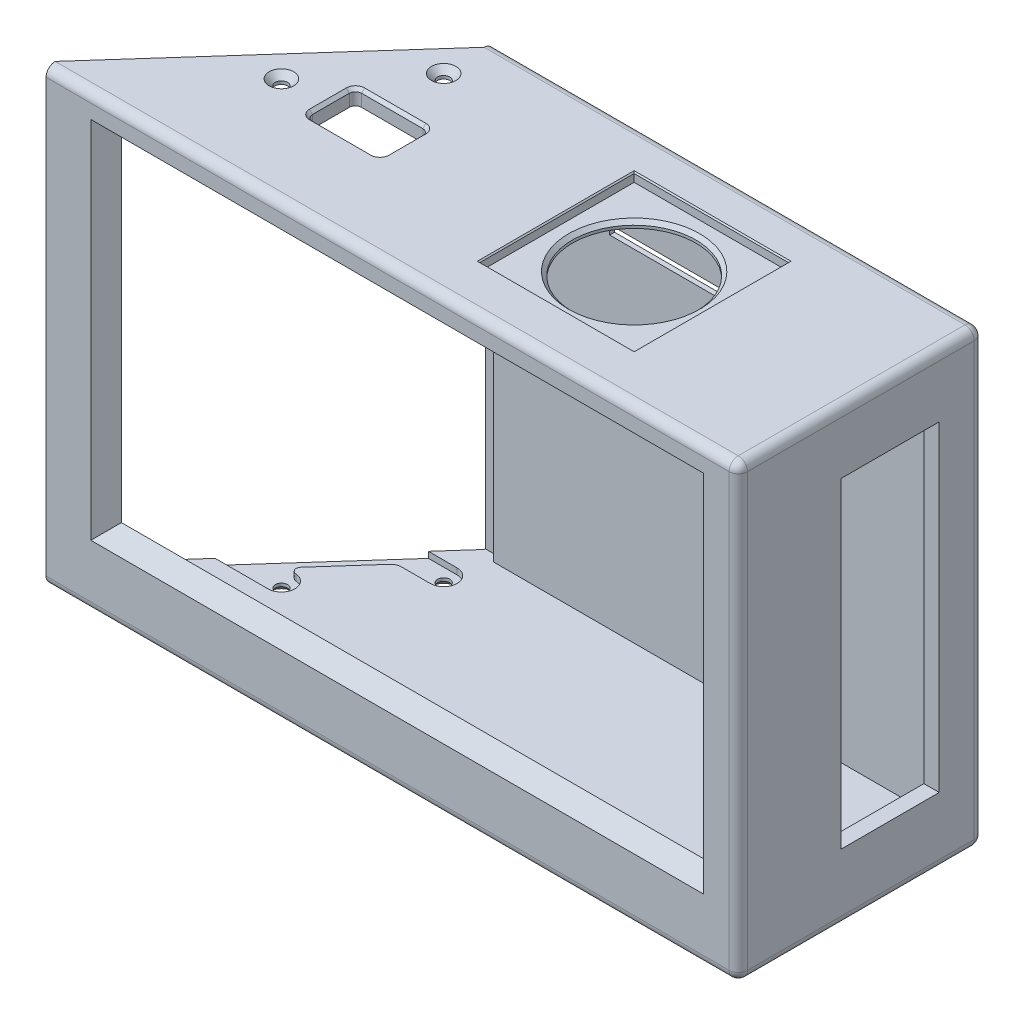
from build123d import *

# Parameters (mm, degrees)
BOSS_EXTRU_1_DEPTH       = 68.5
BOSS_EXTRU_2_DEPTH       = 2.5
ESQUISSE4_W              = 95
ESQUISSE4_H              = 54.5
ENL_V_MAT_EXTRU_1_DEPTH  = 2.5
ESQUISSE5_W              = 16
ESQUISSE5_H              = 52.4
ENL_V_MAT_EXTRU_2_DEPTH  = 2.5
BOSS_EXTRU_3_DEPTH       = 2.5
CHANFREIN1_SIZE          = 2.5
CONG_1_R                 = 1.5
ENL_V_MAT_EXTRU_3_DEPTH  = 1.2
CHANFREIN2_SIZE          = 0.3
ESQUISSE8_W              = 20
ESQUISSE8_H              = 1
ENL_V_MAT_EXTRU_4_DEPTH  = 3
CHANFREIN3_SIZE          = 0.5
CHANFREIN4_SIZE          = 0.5
ESQUISSE9_R              = 1
ENL_V_MAT_EXTRU_5_DEPTH  = 75
CHANFREIN5_SIZE          = 1
CHANFREIN6_SIZE          = 1
ENL_V_MAT_EXTRU_6_DEPTH  = 1
ENL_V_START              = -1
ENL_V_MAT_EXTRU_7_DEPTH  = 1
ESQUISSE13_W             = 12
ESQUISSE13_H             = 8
ENL_V_MAT_EXTRU_8_DEPTH  = 2.5
CONG_2_R                 = 1
CHANFREIN7_SIZE          = 0.5
ESQUISSE14_W             = 25.2
ESQUISSE14_H             = 25.2
ENL_V_MAT_EXTRU_9_DEPTH  = 1.45
CHANFREIN8_SIZE          = 0.2
ESQUISSE15_R             = 10.1
ENL_V_MAT_EXTRU_10_DEPTH = 1.05
CHANFREIN9_SIZE          = 0.6


with BuildPart() as part:
    # Esquisse2 → Boss.-Extru.1 (new body)
    with BuildSketch(Plane(origin=(0, 0, 0), x_dir=(1, 0, 0), z_dir=(0, 1, 0))):
        Polygon((0, 0), (113, 0), (113, 40), (33, 40), (33, 38.7), (35.5, 38.7), (35.5, 37.5), (110.5, 37.5), (110.5, 2.5), (2.5, 2.5), (2.5, 1.3), (0, 1.3), align=None)
    extrude(amount=BOSS_EXTRU_1_DEPTH)

    # Esquisse3 → Boss.-Extru.2 (add)
    with BuildSketch(Plane.XZ):
        Polygon((0, 0), (113, 0), (113, -40), (33, -40), (33, -38.5), (0, -1.5), align=None)
    extrude(amount=BOSS_EXTRU_2_DEPTH)

    # Esquisse4 → Enlèv. mat.-Extru.1 (cut)
    with BuildSketch(Plane.XY):
        with Locations((57.3, 37.45)):
            Rectangle(ESQUISSE4_W, ESQUISSE4_H)
    extrude(amount=-ENL_V_MAT_EXTRU_1_DEPTH, mode=Mode.SUBTRACT)

    # Esquisse5 → Enlèv. mat.-Extru.2 (cut)
    with BuildSketch(Plane(origin=(113, 0, 0), x_dir=(0, 0, -1), z_dir=(1, 0, 0))):
        with Locations((24.8, 34.7)):
            Rectangle(ESQUISSE5_W, ESQUISSE5_H)
    extrude(amount=-ENL_V_MAT_EXTRU_2_DEPTH, mode=Mode.SUBTRACT)

    # Esquisse6 → Boss.-Extru.3 (add)
    with BuildSketch(Plane(origin=(0, 68.5, 0), x_dir=(1, 0, 0), z_dir=(0, 1, 0))):
        Polygon((33, 40), (33, 38.5), (0, 1.5), (0, 0), (113, 0), (113, 40), align=None)
    extrude(amount=BOSS_EXTRU_3_DEPTH)

    # Chanfrein1
    chanfrein1_edges = [part.edges().sort_by_distance(p)[0] for p in [
        (57.3, 10.2, 0),
        (104.8, 37.45, 0),
        (57.3, 64.7, 0),
        (9.8, 37.45, 0),
    ]]
    chamfer(chanfrein1_edges, length=CHANFREIN1_SIZE - 0.0001)  # a hair under: the kernel refuses the full size

    # Congé1
    cong_1_edges = [part.edges().sort_by_distance(p)[0] for p in [
        (73, -2.5, -40),
        (113, -2.5, -20),
        (113, 34.25, -40),
        (56.5, -2.5, 0),
        (113, 34.25, 0),
        (73, 71, -40),
        (113, 71, -20),
        (56.5, 71, 0),
    ]]
    fillet(cong_1_edges, radius=CONG_1_R)

    # Esquisse7 → Enlèv. mat.-Extru.3 (cut)
    with BuildSketch(Plane(origin=(0, 0, -40), x_dir=(-1, 0, 0), z_dir=(0, 0, -1))):
        Polygon((-86.45, 56.7), (-42.55, 56.7), (-42.55, 13.2), (-39.8, 13.2), (-39.8, 10.3), (-89.2, 10.3), (-89.2, 13.2), (-86.45, 13.2), align=None)
    extrude(amount=-ENL_V_MAT_EXTRU_3_DEPTH, mode=Mode.SUBTRACT)

    # Chanfrein2
    chanfrein2_edges = [part.edges().sort_by_distance(p)[0] for p in [
        (86.45, 34.95, -40),
        (87.825, 13.2, -40),
        (89.2, 11.75, -40),
        (64.5, 10.3, -40),
        (39.8, 11.75, -40),
        (41.175, 13.2, -40),
        (42.55, 34.95, -40),
        (64.5, 56.7, -40),
    ]]
    chamfer(chanfrein2_edges, length=CHANFREIN2_SIZE)

    # Esquisse8 → Enlèv. mat.-Extru.4 (cut)
    with BuildSketch(Plane(origin=(0, 0, -38.8), x_dir=(-1, 0, 0), z_dir=(0, 0, -1))):
        with Locations((-64.5, 56.2)):
            Rectangle(ESQUISSE8_W, ESQUISSE8_H)
    extrude(amount=-ENL_V_MAT_EXTRU_4_DEPTH, mode=Mode.SUBTRACT)

    # Chanfrein3
    chanfrein3_edges = [part.edges().sort_by_distance(p)[0] for p in [
        (74.5, 56.2, -38.8),
        (64.5, 55.7, -38.8),
        (54.5, 56.2, -38.8),
    ]]
    chamfer(chanfrein3_edges, length=CHANFREIN3_SIZE)

    # Chanfrein4
    chanfrein4_edges = [part.edges().sort_by_distance(p)[0] for p in [
        (64.5, 56.7, -37.5),
    ]]
    chamfer(chanfrein4_edges, length=CHANFREIN4_SIZE)

    # Esquisse9 → Enlèv. mat.-Extru.5 (cut)
    with BuildSketch(Plane(origin=(0, 71, 0), x_dir=(1, 0, 0), z_dir=(0, 1, 0))):
        with Locations(Location((20.92027027, 17.5, 0), (0, 0, 270))):
            Circle(ESQUISSE9_R)
        with Locations(Location((33.406756757, 31.5, 0), (0, 0, 270))):
            Circle(ESQUISSE9_R)
    extrude(amount=-ENL_V_MAT_EXTRU_5_DEPTH, mode=Mode.SUBTRACT)

    # Chanfrein5
    chanfrein5_edges = [part.edges().sort_by_distance(p)[0] for p in [
        (20.92027027, 71, -18.5),
        (33.406756757, 71, -32.5),
    ]]
    chamfer(chanfrein5_edges, length=CHANFREIN5_SIZE)

    # Chanfrein6
    chanfrein6_edges = [part.edges().sort_by_distance(p)[0] for p in [
        (20.92027027, -2.5, -18.5),
        (33.406756757, -2.5, -32.5),
    ]]
    chamfer(chanfrein6_edges, length=CHANFREIN6_SIZE)

    # Esquisse10 → Enlèv. mat.-Extru.6 (cut)
    with BuildSketch(Plane(origin=(0, 0, 0), x_dir=(1, 0, 0), z_dir=(0, 1, 0))):
        with BuildLine():
            Line((12.040050277, 15.299924377), (28.450890894, 33.699957797))
            Line((28.450890894, 33.699957797), (33.406738022, 33.7))
            ThreePointArc((33.406738022, 33.7), (35.606756752, 31.499854993), (33.406448008, 29.300000022))
            Line((33.406448008, 29.300000022), (28.735619265, 29.300655526))
            ThreePointArc((28.735619265, 29.300655526), (27.99947652, 29.143356281), (27.392034871, 28.698762269))
            Line((27.392034871, 28.698762269), (20.547584791, 21.024681875))
            ThreePointArc((20.547584791, 21.024681875), (20.399896986, 20.199981277), (21.069011886, 19.695770987))
            Line((21.069011886, 19.695770987), (21.128195715, 19.69015228))
            ThreePointArc((21.128195715, 19.69015228), (23.117807404, 17.395930099), (20.920289005, 15.3))
            Line((20.920289005, 15.3), (12.040050277, 15.299924377))
        make_face()
    extrude(amount=-ENL_V_MAT_EXTRU_6_DEPTH, mode=Mode.SUBTRACT)

    # Esquisse12 → Enlèv. mat.-Extru.7 (cut)
    with BuildSketch(Plane.XZ.offset(-68.5).offset(ENL_V_START)):
        with BuildLine():
            Line((12.308108108, -15.3), (20.92027027, -15.3))
            ThreePointArc((20.92027027, -15.3), (23.11421416, -17.336873648), (21.245624873, -19.675808903))
            Line((21.245624873, -19.675808903), (21.03224488, -19.707716192))
            ThreePointArc((21.03224488, -19.707716192), (20.398241002, -20.226848336), (20.553531675, -21.031425186))
            Line((20.553531675, -21.031425186), (27.392315335, -28.698793496))
            ThreePointArc((27.392315335, -28.698793496), (27.999748232, -29.143364838), (28.735871891, -29.300655526))
            Line((28.735871891, -29.300655526), (33.406447992, -29.300000022))
            ThreePointArc((33.406447992, -29.300000022), (35.606756752, -31.499854985), (33.406738022, -33.7))
            Line((33.406738022, -33.7), (28.718883313, -33.699960079))
            Line((28.718883313, -33.699960079), (12.308108108, -15.3))
        make_face()
    extrude(amount=ENL_V_MAT_EXTRU_7_DEPTH, mode=Mode.SUBTRACT)

    # Esquisse13 → Enlèv. mat.-Extru.8 (cut)
    with BuildSketch(Plane(origin=(0, 71, 0), x_dir=(1, 0, 0), z_dir=(0, 1, 0))):
        with Locations((34, 18.5)):
            Rectangle(ESQUISSE13_W, ESQUISSE13_H)
    extrude(amount=-ENL_V_MAT_EXTRU_8_DEPTH, mode=Mode.SUBTRACT)

    # Congé2
    cong_2_edges = [part.edges().sort_by_distance(p)[0] for p in [
        (28, 69.75, -14.5),
        (28, 69.75, -22.5),
        (40, 69.75, -22.5),
        (40, 69.75, -14.5),
    ]]
    fillet(cong_2_edges, radius=CONG_2_R)

    # Chanfrein7
    chanfrein7_edges = [part.edges().sort_by_distance(p)[0] for p in [
        (28, 71, -18.5),
        (34, 71, -22.5),
        (40, 71, -18.5),
        (34, 71, -14.5),
        (28.292893219, 71, -22.207106781),
        (39.707106781, 71, -22.207106781),
        (39.707106781, 71, -14.792893219),
        (28.292893219, 71, -14.792893219),
    ]]
    chamfer(chanfrein7_edges, length=CHANFREIN7_SIZE)

    # Esquisse14 → Enlèv. mat.-Extru.9 (cut)
    with BuildSketch(Plane(origin=(0, 71, 0), x_dir=(1, 0, 0), z_dir=(0, 1, 0))):
        with Locations((75.5, 20.5)):
            Rectangle(ESQUISSE14_W, ESQUISSE14_H)
    extrude(amount=-ENL_V_MAT_EXTRU_9_DEPTH, mode=Mode.SUBTRACT)

    # Chanfrein8
    chanfrein8_edges = [part.edges().sort_by_distance(p)[0] for p in [
        (62.9, 71, -20.5),
        (75.5, 71, -7.9),
        (88.1, 71, -20.5),
        (75.5, 71, -33.1),
    ]]
    chamfer(chanfrein8_edges, length=CHANFREIN8_SIZE)

    # Esquisse15 → Enlèv. mat.-Extru.10 (cut)
    with BuildSketch(Plane(origin=(0, 69.55, 0), x_dir=(1, 0, 0), z_dir=(0, 1, 0))):
        with Locations(Location((75.5, 20.5, 0), (0, 0, 270))):
            Circle(ESQUISSE15_R)
    extrude(amount=-ENL_V_MAT_EXTRU_10_DEPTH, mode=Mode.SUBTRACT)

    # Chanfrein9
    chanfrein9_edges = [part.edges().sort_by_distance(p)[0] for p in [
        (75.5, 69.55, -30.6),
    ]]
    chamfer(chanfrein9_edges, length=CHANFREIN9_SIZE)


solid = part.part
